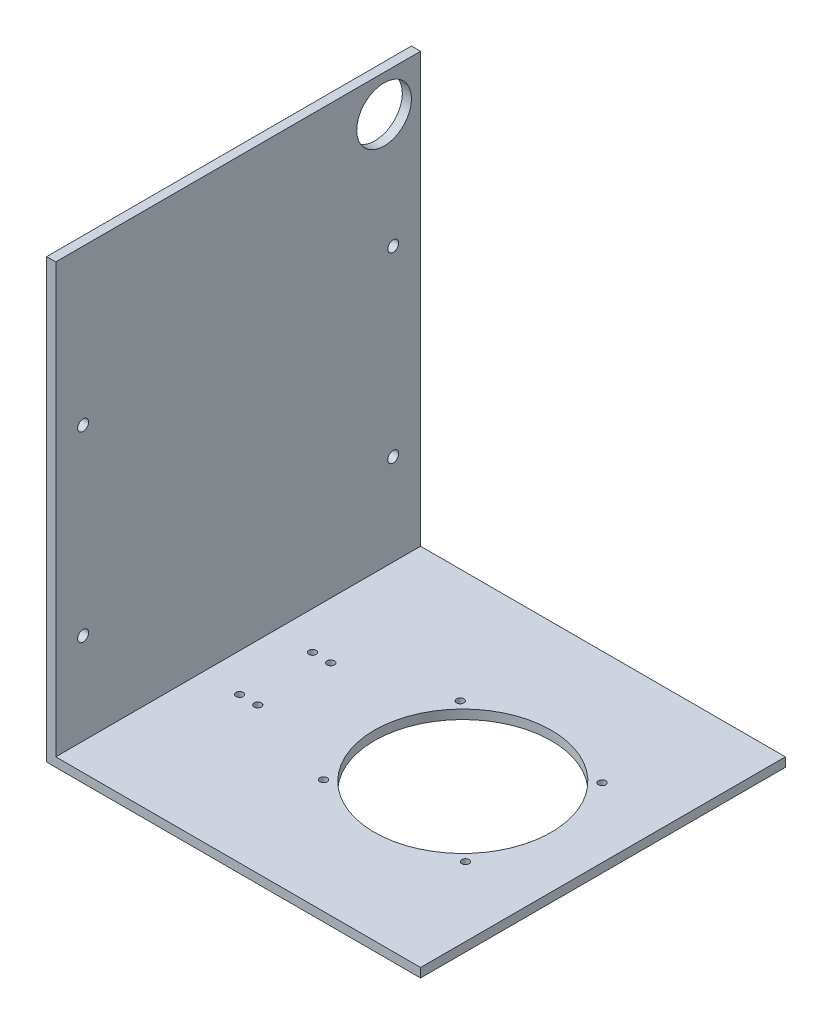
from build123d import *

# Parameters (mm, degrees)
BOSS_EXTRUDE1_DEPTH = 200
CUT_EXTRUDE1_REACH  = 372.473
SKETCH2_R           = 48.5
SKETCH2_R_2         = 2
CUT_EXTRUDE2_REACH  = 372.473
SKETCH3_R           = 2
SKETCH4_R           = 15
CUT_EXTRUDE3_DEPTH  = 10
CUT_EXTRUDE4_REACH  = 372.945
SKETCH5_R           = 3


with BuildPart() as part:
    # Sketch1 → Boss-Extrude1 (new body)
    with BuildSketch(Plane.XY):
        Polygon((0, 240), (0, 0), (205, 0), (205, 5), (5, 5), (5, 240), align=None)
    extrude(amount=BOSS_EXTRUDE1_DEPTH)

    # Sketch2 → Cut-Extrude1 (cut, up to next)
    with BuildSketch(Plane(origin=(0, 5, 0), x_dir=(1, 0, 0), z_dir=(0, 1, 0)), mode=Mode.PRIVATE) as cut_extrude1_sk1:
        with Locations((128.16761425, -100)):
            Circle(SKETCH2_R)
    cut_extrude1_tool1 = extrude(cut_extrude1_sk1.sketch, amount=-CUT_EXTRUDE1_REACH, mode=Mode.PRIVATE) & part.part
    # Sketch2 → Cut-Extrude1 (cut, up to next)
    with BuildSketch(Plane(origin=(0, 5, 0), x_dir=(1, 0, 0), z_dir=(0, 1, 0)), mode=Mode.PRIVATE) as cut_extrude1_sk2:
        with Locations((89.277796733, -62.535588975)):
            Circle(SKETCH2_R_2)
    cut_extrude1_tool2 = extrude(cut_extrude1_sk2.sketch, amount=-CUT_EXTRUDE1_REACH, mode=Mode.PRIVATE) & part.part
    # Sketch2 → Cut-Extrude1 (cut, up to next)
    with BuildSketch(Plane(origin=(0, 5, 0), x_dir=(1, 0, 0), z_dir=(0, 1, 0)), mode=Mode.PRIVATE) as cut_extrude1_sk3:
        with Locations((167.057431768, -62.535588975)):
            Circle(SKETCH2_R_2)
    cut_extrude1_tool3 = extrude(cut_extrude1_sk3.sketch, amount=-CUT_EXTRUDE1_REACH, mode=Mode.PRIVATE) & part.part
    # Sketch2 → Cut-Extrude1 (cut, up to next)
    with BuildSketch(Plane(origin=(0, 5, 0), x_dir=(1, 0, 0), z_dir=(0, 1, 0)), mode=Mode.PRIVATE) as cut_extrude1_sk4:
        with Locations((89.277796733, -137.464411025)):
            Circle(SKETCH2_R_2)
    cut_extrude1_tool4 = extrude(cut_extrude1_sk4.sketch, amount=-CUT_EXTRUDE1_REACH, mode=Mode.PRIVATE) & part.part
    # Sketch2 → Cut-Extrude1 (cut, up to next)
    with BuildSketch(Plane(origin=(0, 5, 0), x_dir=(1, 0, 0), z_dir=(0, 1, 0)), mode=Mode.PRIVATE) as cut_extrude1_sk5:
        with Locations((167.057431768, -137.464411025)):
            Circle(SKETCH2_R_2)
    cut_extrude1_tool5 = extrude(cut_extrude1_sk5.sketch, amount=-CUT_EXTRUDE1_REACH, mode=Mode.PRIVATE) & part.part
    add(cut_extrude1_tool1.solids().sort_by_distance((128.167614, 5, 100))[0], mode=Mode.SUBTRACT)
    add(cut_extrude1_tool2.solids().sort_by_distance((89.277797, 5, 62.535589))[0], mode=Mode.SUBTRACT)
    add(cut_extrude1_tool3.solids().sort_by_distance((167.057432, 5, 62.535589))[0], mode=Mode.SUBTRACT)
    add(cut_extrude1_tool4.solids().sort_by_distance((89.277797, 5, 137.464411))[0], mode=Mode.SUBTRACT)
    add(cut_extrude1_tool5.solids().sort_by_distance((167.057432, 5, 137.464411))[0], mode=Mode.SUBTRACT)

    # Sketch3 → Cut-Extrude2 (cut, up to next)
    with BuildSketch(Plane(origin=(0, 5, 0), x_dir=(1, 0, 0), z_dir=(0, 1, 0)), mode=Mode.PRIVATE) as cut_extrude2_sk1:
        with Locations((25.75, -80)):
            Circle(SKETCH3_R)
    cut_extrude2_tool1 = extrude(cut_extrude2_sk1.sketch, amount=-CUT_EXTRUDE2_REACH, mode=Mode.PRIVATE) & part.part
    # Sketch3 → Cut-Extrude2 (cut, up to next)
    with BuildSketch(Plane(origin=(0, 5, 0), x_dir=(1, 0, 0), z_dir=(0, 1, 0)), mode=Mode.PRIVATE) as cut_extrude2_sk2:
        with Locations((25.75, -120)):
            Circle(SKETCH3_R)
    cut_extrude2_tool2 = extrude(cut_extrude2_sk2.sketch, amount=-CUT_EXTRUDE2_REACH, mode=Mode.PRIVATE) & part.part
    # Sketch3 → Cut-Extrude2 (cut, up to next)
    with BuildSketch(Plane(origin=(0, 5, 0), x_dir=(1, 0, 0), z_dir=(0, 1, 0)), mode=Mode.PRIVATE) as cut_extrude2_sk3:
        with Locations((35.75, -120)):
            Circle(SKETCH3_R)
    cut_extrude2_tool3 = extrude(cut_extrude2_sk3.sketch, amount=-CUT_EXTRUDE2_REACH, mode=Mode.PRIVATE) & part.part
    # Sketch3 → Cut-Extrude2 (cut, up to next)
    with BuildSketch(Plane(origin=(0, 5, 0), x_dir=(1, 0, 0), z_dir=(0, 1, 0)), mode=Mode.PRIVATE) as cut_extrude2_sk4:
        with Locations((35.75, -80)):
            Circle(SKETCH3_R)
    cut_extrude2_tool4 = extrude(cut_extrude2_sk4.sketch, amount=-CUT_EXTRUDE2_REACH, mode=Mode.PRIVATE) & part.part
    add(cut_extrude2_tool1.solids().sort_by_distance((25.75, 5, 80))[0], mode=Mode.SUBTRACT)
    add(cut_extrude2_tool2.solids().sort_by_distance((25.75, 5, 120))[0], mode=Mode.SUBTRACT)
    add(cut_extrude2_tool3.solids().sort_by_distance((35.75, 5, 120))[0], mode=Mode.SUBTRACT)
    add(cut_extrude2_tool4.solids().sort_by_distance((35.75, 5, 80))[0], mode=Mode.SUBTRACT)

    # Sketch4 → Cut-Extrude3 (cut)
    with BuildSketch(Plane(origin=(5, 0, 0), x_dir=(0, 0, -1), z_dir=(1, 0, 0))):
        with Locations((-20, 220)):
            Circle(SKETCH4_R)
    extrude(amount=-CUT_EXTRUDE3_DEPTH, mode=Mode.SUBTRACT)

    # Sketch5 → Cut-Extrude4 (cut, up to next)
    with BuildSketch(Plane(origin=(5, 0, 0), x_dir=(0, 0, -1), z_dir=(1, 0, 0)), mode=Mode.PRIVATE) as cut_extrude4_sk1:
        with Locations((-185, 55)):
            Circle(SKETCH5_R)
    cut_extrude4_tool1 = extrude(cut_extrude4_sk1.sketch, amount=-CUT_EXTRUDE4_REACH, mode=Mode.PRIVATE) & part.part
    # Sketch5 → Cut-Extrude4 (cut, up to next)
    with BuildSketch(Plane(origin=(5, 0, 0), x_dir=(0, 0, -1), z_dir=(1, 0, 0)), mode=Mode.PRIVATE) as cut_extrude4_sk2:
        with Locations((-185, 155)):
            Circle(SKETCH5_R)
    cut_extrude4_tool2 = extrude(cut_extrude4_sk2.sketch, amount=-CUT_EXTRUDE4_REACH, mode=Mode.PRIVATE) & part.part
    # Sketch5 → Cut-Extrude4 (cut, up to next)
    with BuildSketch(Plane(origin=(5, 0, 0), x_dir=(0, 0, -1), z_dir=(1, 0, 0)), mode=Mode.PRIVATE) as cut_extrude4_sk3:
        with Locations((-15, 55)):
            Circle(SKETCH5_R)
    cut_extrude4_tool3 = extrude(cut_extrude4_sk3.sketch, amount=-CUT_EXTRUDE4_REACH, mode=Mode.PRIVATE) & part.part
    # Sketch5 → Cut-Extrude4 (cut, up to next)
    with BuildSketch(Plane(origin=(5, 0, 0), x_dir=(0, 0, -1), z_dir=(1, 0, 0)), mode=Mode.PRIVATE) as cut_extrude4_sk4:
        with Locations((-15, 155)):
            Circle(SKETCH5_R)
    cut_extrude4_tool4 = extrude(cut_extrude4_sk4.sketch, amount=-CUT_EXTRUDE4_REACH, mode=Mode.PRIVATE) & part.part
    add(cut_extrude4_tool1.solids().sort_by_distance((5, 55, 185))[0], mode=Mode.SUBTRACT)
    add(cut_extrude4_tool2.solids().sort_by_distance((5, 155, 185))[0], mode=Mode.SUBTRACT)
    add(cut_extrude4_tool3.solids().sort_by_distance((5, 55, 15))[0], mode=Mode.SUBTRACT)
    add(cut_extrude4_tool4.solids().sort_by_distance((5, 155, 15))[0], mode=Mode.SUBTRACT)


solid = part.part
